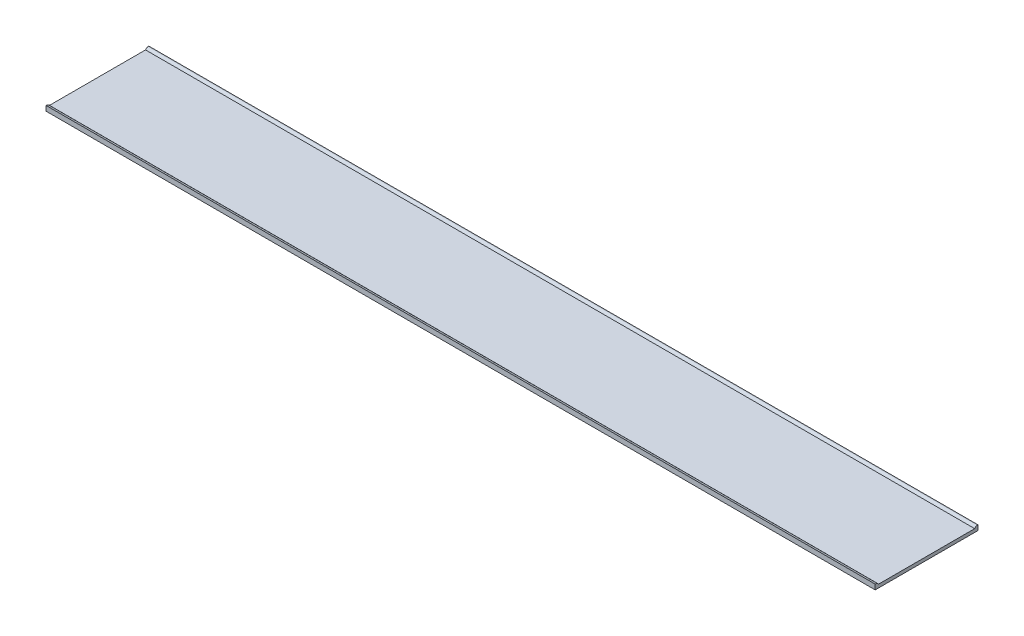
from build123d import *

# Parameters (mm, degrees)
CROQUIS1_W              = 500
CROQUIS1_H              = 58
SALIENTE_EXTRUIR1_DEPTH = 2
CROQUIS4_W              = 500
CROQUIS4_H              = 2
SALIENTE_EXTRUIR2_DEPTH = 3
REDONDEO1_R             = 2


with BuildPart() as part:
    # Croquis1 → Saliente-Extruir1 (new body)
    with BuildSketch(Plane(origin=(0, 0, 0), x_dir=(1, 0, 0), z_dir=(0, 1, 0))):
        Rectangle(CROQUIS1_W, CROQUIS1_H)
    extrude(amount=SALIENTE_EXTRUIR1_DEPTH)

    # Croquis4 → Saliente-Extruir2 (add)
    with BuildSketch(Plane(origin=(0, 0, 0), x_dir=(1, 0, 0), z_dir=(0, 1, 0))):
        with Locations((0, 30)):
            Rectangle(CROQUIS4_W, CROQUIS4_H)
        with Locations((0, -30)):
            Rectangle(CROQUIS4_W, CROQUIS4_H)
    extrude(amount=SALIENTE_EXTRUIR2_DEPTH)

    # Redondeo1
    # the kernel refuses this fillet: 2 mm, written as the material it takes off along each edge
    with BuildSketch(Plane(origin=(254.330127019, 3, -29), x_dir=(0, 0, -1), z_dir=(-1, 0, 0))) as redondeo1_piece_1:
        with BuildLine():
            CenterArc((1.732050808, 2), REDONDEO1_R, 210, 60)
            Line((0, 1), (-0.034641016, 0.98))
            ThreePointArc((-0.034641016, 0.98), (-0.04, 0.5), (-0.04, 0))
            Line((-0.04, 0), (0, -0.04))
            Line((0, -0.04), (1.732050808, -0.04))
            Line((1.732050808, -0.04), (1.732050808, 0))
        make_face()
    extrude(amount=508.660254038, mode=Mode.SUBTRACT)
    with BuildSketch(Plane(origin=(-254.330127019, 3, 29), x_dir=(0, -1, 0), z_dir=(1, 0, 0))) as redondeo1_piece_2:
        with BuildLine():
            CenterArc((2, -1.732050808), REDONDEO1_R, 120, 60)
            Line((0, -1.732050808), (-0.04, -1.732050808))
            Line((-0.04, -1.732050808), (-0.04, 0))
            Line((-0.04, 0), (0, 0.04))
            ThreePointArc((0, 0.04), (0.5, 0.04), (0.98, 0.034641016))
            Line((0.98, 0.034641016), (1, 0))
        make_face()
    extrude(amount=508.660254038, mode=Mode.SUBTRACT)


solid = part.part
